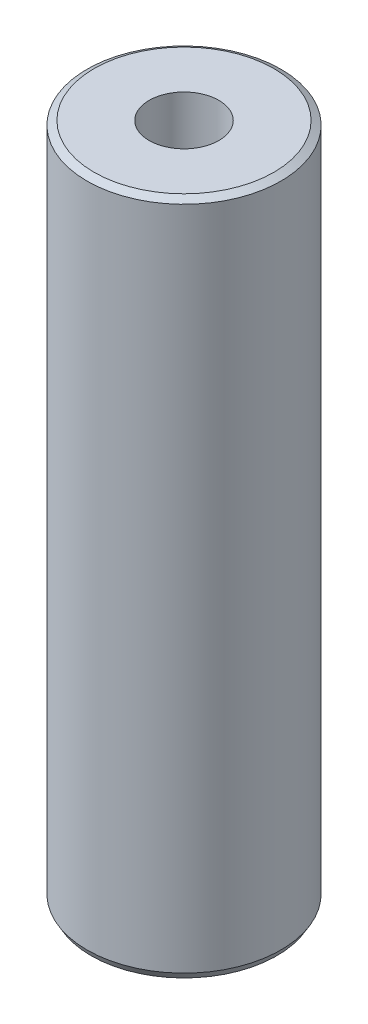
from build123d import *
from OCP.BRepFilletAPI import BRepFilletAPI_MakeChamfer

# Parameters (mm, degrees)
SKETCH1_R           = 17.5
BOSS_EXTRUDE1_DEPTH = 122.192010858
SKETCH2_R           = 6.290532067
CUT_EXTRUDE1_DEPTH  = 125.673122675
CHAMFER1_SIZE       = 0.737328249
CHAMFER1_SIZE2      = 1.277089989


with BuildPart() as part:
    # Sketch1 → Boss-Extrude1 (new body)
    with BuildSketch(Plane(origin=(0, 0, 0), x_dir=(1, 0, 0), z_dir=(0, 1, 0))):
        Circle(SKETCH1_R)
    extrude(amount=BOSS_EXTRUDE1_DEPTH)

    # Sketch2 → Cut-Extrude1 (cut, through all)
    with BuildSketch(Plane(origin=(0, 0, 0), x_dir=(1, 0, 0), z_dir=(0, 1, 0))):
        Circle(SKETCH2_R)
    extrude(amount=CUT_EXTRUDE1_DEPTH, mode=Mode.SUBTRACT)

    # Chamfer1: one chamfer whose edges measure the first distance from different faces: ONE call of the kernel's chamfer builder (chamfer() names one face for all edges)
    chamfer1_edges_1 = [part.edges().sort_by_distance(p)[0] for p in [
        (-17.5, 122.192010858, 0),
    ]]
    chamfer1_side_1 = [part.faces().sort_by_distance(p)[0] for p in [
        (-17.5, 61.096005429, 0),
    ]]
    chamfer1_edges_2 = [part.edges().sort_by_distance(p)[0] for p in [
        (-17.5, 0, 0),
    ]]
    chamfer1_side_2 = [part.faces().sort_by_distance(p)[0] for p in [
        (-17.005025253, 0, 0),
    ]]
    chamfer1 = BRepFilletAPI_MakeChamfer(part.part.solid().wrapped)
    for e in chamfer1_edges_1:
        chamfer1.Add(CHAMFER1_SIZE, CHAMFER1_SIZE2, e.wrapped, chamfer1_side_1[0].wrapped)  # the first distance lies on this face
    for e in chamfer1_edges_2:
        chamfer1.Add(CHAMFER1_SIZE, CHAMFER1_SIZE2, e.wrapped, chamfer1_side_2[0].wrapped)  # the first distance lies on this face
    add(Compound.cast(chamfer1.Shape()), mode=Mode.REPLACE)


solid = part.part
